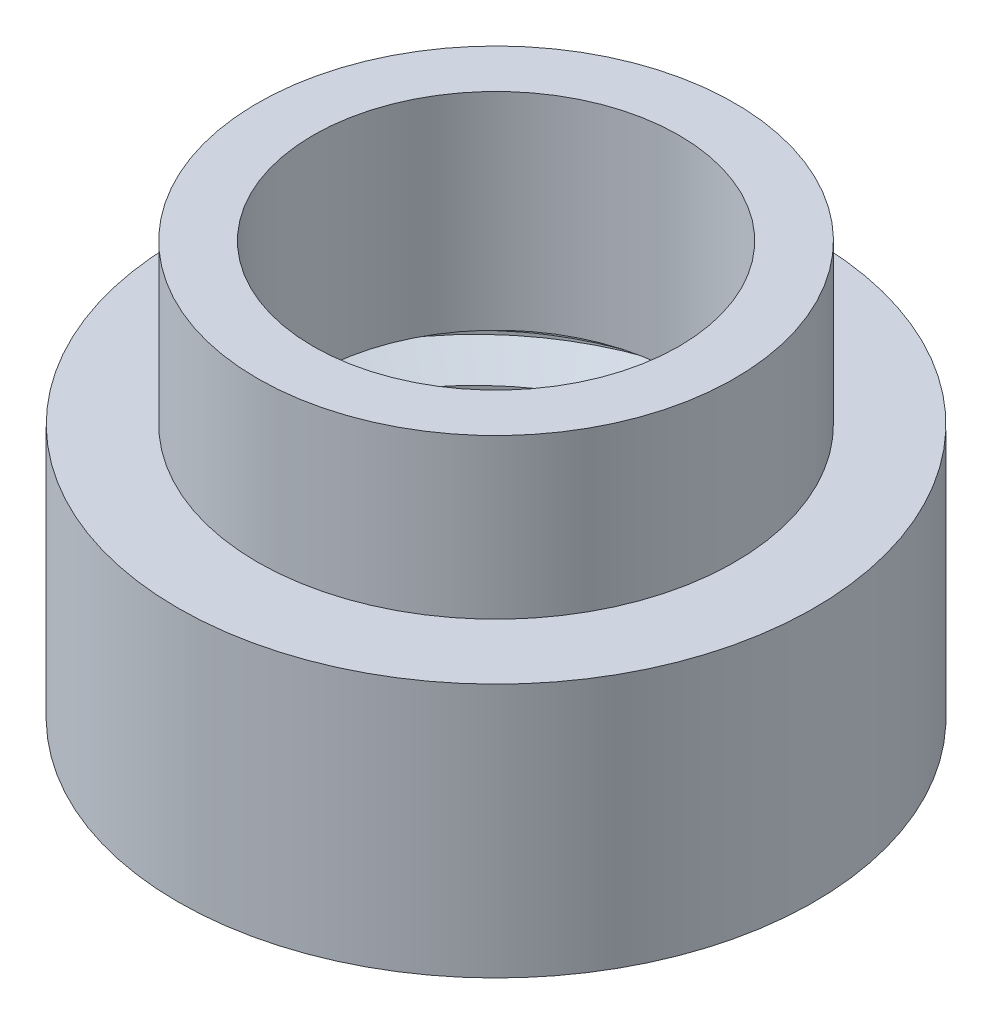
from build123d import *

# Parameters (mm, degrees)
THREAD1_PITCH = 2


with BuildPart() as part:
    # Sketch1 → Revolve1 (revolve)
    with BuildSketch(Plane(origin=(0, 0, 0), x_dir=(0, 0, -1), z_dir=(1, 0, 0))):
        Polygon((-7.5, 2.5), (-7.5, -4), (-10, -4), (-10, 4), (-7.5, 4), (-7.5, 9), (-5.75, 9), (-5.75, 2.5), align=None)
    revolve(axis=Axis((0, 15.090909091, 0), (0, -1, 0)))

    # Thread1: the profile of Thread Profile1 profile screwed along a right-hand helix of 5 turns, 10 arcs to a turn; built about Z, then put on its axis
    thread1_z = Axis((0, 0, 0), (0, 0, 1))
    thread1_corners = [(7.4997, 0, -0.000173205), (8.58253175, 0, 0.624999997), (8.58253175, 0, 0.874999997), (7.4997, 0, 1.5001732)]
    with BuildLine(mode=Mode.PRIVATE) as thread1_profile:
        Line(thread1_corners[0], thread1_corners[1])
        Line(thread1_corners[1], thread1_corners[2])
        Line(thread1_corners[2], thread1_corners[3])
        Line(thread1_corners[3], thread1_corners[0])
    thread1_cap = Face(thread1_profile.wire())
    thread1_turn_angles = [0, 18, 36, 54, 72, 90, 108, 126, 144, 162, 180, 198, 216, 234, 252, 270, 288, 306, 324, 342, 360]
    thread1_turn_weights = [1, 0.9510565162951535, 1, 0.9510565162951535, 1, 0.9510565162951535, 1, 0.9510565162951535, 1, 0.9510565162951535, 1, 0.9510565162951535, 1, 0.9510565162951535, 1, 0.9510565162951535, 1, 0.9510565162951535, 1, 0.9510565162951535, 1]
    thread1_turn_rails = [Edge.make_bspline([Vector(p[0], p[1], 0).rotate(thread1_z, thread1_turn_angles[k]) / thread1_turn_weights[k] + Vector(0, 0, p[2] + THREAD1_PITCH * thread1_turn_angles[k] / 360) for k in range(21)], [0, 0, 0, 1, 1, 2, 2, 3, 3, 4, 4, 5, 5, 6, 6, 7, 7, 8, 8, 9, 9, 10, 10, 10], 2, thread1_turn_weights) for p in thread1_corners]
    thread1_turn_sides = [Face.make_surface_from_curves(thread1_turn_rails[p[0]], thread1_turn_rails[p[1]]) for p in [(0, 1), (1, 2), (2, 3), (3, 0)]]
    thread1 = Plane(origin=(0, -9, 0), x_dir=(1, 0, 0), z_dir=(0, 1, 0)) * Solid(Shell([*[p.moved(Location((0, 0, THREAD1_PITCH * i))) for i in range(5) for p in thread1_turn_sides], thread1_cap, thread1_cap.rotate(thread1_z, 1800).moved(Location((0, 0, THREAD1_PITCH * 1800 / 360)))]))
    add(thread1, mode=Mode.SUBTRACT)


solid = part.part
